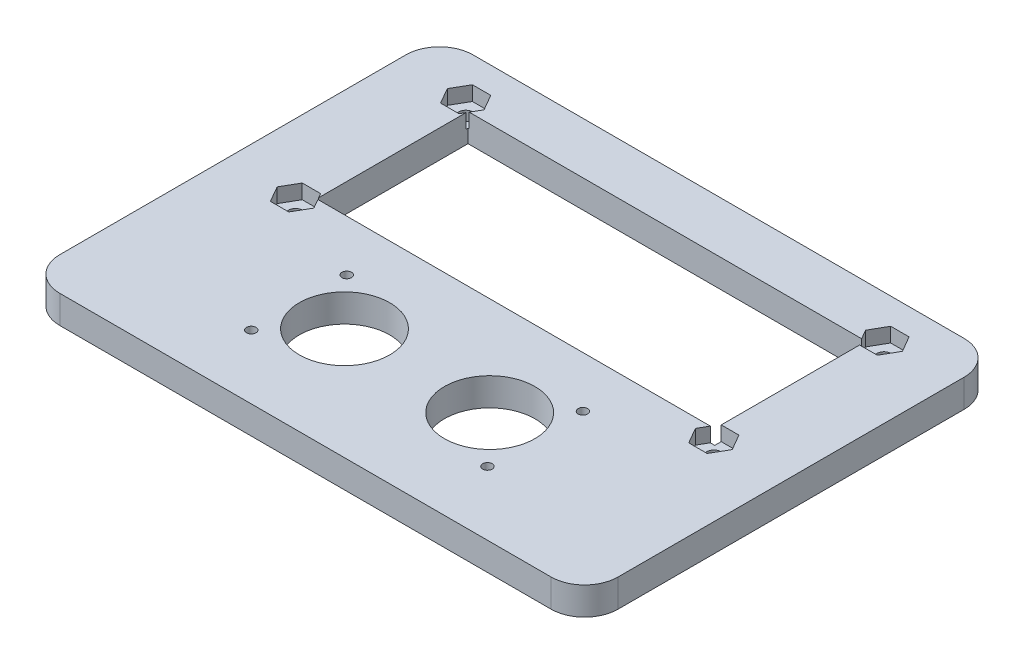
from build123d import *

# Parameters (mm, degrees)
SKETCH1_W                = 100
SKETCH1_H                = 74
BOSS_EXTRUDE1_DEPTH      = 5
SKETCH2_R                = 1.27
SKETCH2_W                = 71.2978
SKETCH2_H                = 27.1018
SCREEN_CUTOUT_DEPTH      = 63.401923047
SCREEN_HEX_NUTS_DEPTH    = 2.6
SKETCH3_R                = 8.1
SKETCH3_R_2              = 0.85
ULTRASOUND_CUTOUTS_DEPTH = 63.401923047
SKETCH5_W                = 12
SKETCH5_H                = 4
US_CLOCK_CUTOUT_DEPTH    = 4
SKETCH6_W                = 10
SKETCH6_H                = 3.5
US_PIN_CUTOUT_DEPTH      = 2
SKETCH9_R                = 3.15
MAGNET_HOLES_DEPTH       = 2.1
FILLET1_R                = 6
FILLET2_R                = 1


with BuildPart() as part:
    # Sketch1 → Boss-Extrude1 (new body)
    with BuildSketch(Plane(origin=(0, 0, 0), x_dir=(1, 0, 0), z_dir=(0, 1, 0))):
        Rectangle(SKETCH1_W, SKETCH1_H)
    extrude(amount=BOSS_EXTRUDE1_DEPTH)

    # Sketch2 → Screen Cutout (cut, through all)
    with BuildSketch(Plane(origin=(0, 5, 0), x_dir=(1, 0, 0), z_dir=(0, 1, 0))):
        with Locations((-37.7571, -1.02)):
            Circle(SKETCH2_R)
        with Locations((37.1729, -1.02)):
            Circle(SKETCH2_R)
        with Locations((37.1729, 29.46)):
            Circle(SKETCH2_R)
        with Locations((-37.7571, 29.46)):
            Circle(SKETCH2_R)
        with Locations((0, 14.22)):
            Rectangle(SKETCH2_W, SKETCH2_H)
    extrude(amount=-SCREEN_CUTOUT_DEPTH, mode=Mode.SUBTRACT)

    # Sketch8 → Screen hex nuts (cut)
    with BuildSketch(Plane(origin=(0, 5, 0), x_dir=(1, 0, 0), z_dir=(0, 1, 0))):
        Polygon((-34.46620408, 29.457989907), (-36.109911249, 32.308994422), (-39.400807169, 32.311004515), (-41.04799592, 29.462010093), (-39.404288751, 26.611005578), (-36.113392831, 26.608995485), align=None)
        Polygon((40.463768082, 29.47368455), (38.806482873, 32.316817634), (35.515614791, 32.303133085), (33.882031918, 29.44631545), (35.539317127, 26.603182366), (38.830185209, 26.616866915), align=None)
        Polygon((40.463796419, -1.019129509), (38.817594343, 1.830435146), (35.526697923, 1.829564655), (33.882003581, -1.020870491), (35.528205657, -3.870435146), (38.819102077, -3.869564655), align=None)
        Polygon((-41.047996534, -1.02), (-39.402548267, -3.87), (-36.111651733, -3.87), (-34.466203466, -1.02), (-36.111651733, 1.83), (-39.402548267, 1.83), align=None)
    extrude(amount=-SCREEN_HEX_NUTS_DEPTH, mode=Mode.SUBTRACT)

    # Sketch3 → Ultrasound Cutouts (cut, through all)
    with BuildSketch(Plane(origin=(0, 5, 0), x_dir=(1, 0, 0), z_dir=(0, 1, 0))):
        with Locations((-13, -17)):
            Circle(SKETCH3_R)
        with Locations((13, -17)):
            Circle(SKETCH3_R)
        with Locations((-21.15, -8.45)):
            Circle(SKETCH3_R_2)
        with Locations((21.15, -8.45)):
            Circle(SKETCH3_R_2)
        with Locations((21.15, -25.55)):
            Circle(SKETCH3_R_2)
        with Locations((-21.15, -25.55)):
            Circle(SKETCH3_R_2)
    extrude(amount=-ULTRASOUND_CUTOUTS_DEPTH, mode=Mode.SUBTRACT)

    # Sketch5 → US Clock cutout (cut)
    with BuildSketch(Plane.XZ):
        with Locations((-0.149666973, 24.387066025)):
            Rectangle(SKETCH5_W, SKETCH5_H)
    extrude(amount=-US_CLOCK_CUTOUT_DEPTH, mode=Mode.SUBTRACT)

    # Sketch6 → US Pin cutout (cut)
    with BuildSketch(Plane.XZ):
        with Locations((0, 8.387066025)):
            Rectangle(SKETCH6_W, SKETCH6_H)
    extrude(amount=-US_PIN_CUTOUT_DEPTH, mode=Mode.SUBTRACT)

    # Sketch9 → Magnet Holes (cut)
    with BuildSketch(Plane(origin=(0, 0.2, 0), x_dir=(-1, 0, 0), z_dir=(0, -1, 0))):
        with Locations((-44, 31)):
            Circle(SKETCH9_R)
        with Locations((44, 31)):
            Circle(SKETCH9_R)
        with Locations((-44, -31)):
            Circle(SKETCH9_R)
        with Locations((44, -31)):
            Circle(SKETCH9_R)
    extrude(amount=-MAGNET_HOLES_DEPTH, mode=Mode.SUBTRACT)

    # Fillet1
    fillet1_edges = [part.edges().sort_by_distance(p)[0] for p in [
        (50, 2.5, -37),
        (50, 2.5, 37),
        (-50, 2.5, 37),
        (-50, 2.5, -37),
    ]]
    fillet(fillet1_edges, radius=FILLET1_R)

    # Fillet2
    fillet2_edges = [part.edges().sort_by_distance(p)[0] for p in [
        (5.850333027, 2, 26.387066025),
        (-6.149666973, 2, 26.387066025),
        (-6.149666973, 2, 22.387066025),
        (5.850333027, 2, 22.387066025),
    ]]
    fillet(fillet2_edges, radius=FILLET2_R)


solid = part.part
